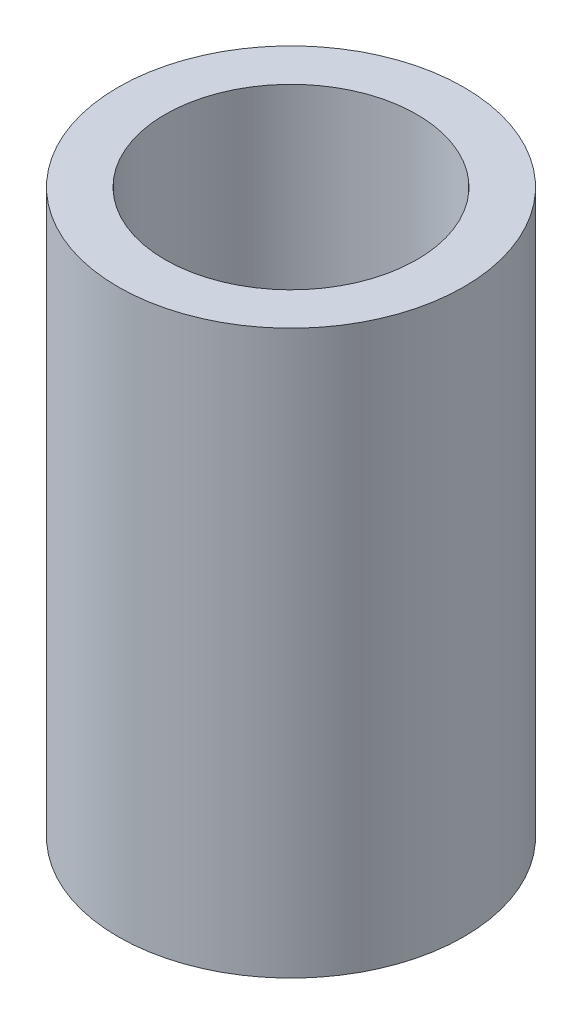
from build123d import *

# Parameters (mm, degrees)
SKETCH1_R           = 20
BOSS_EXTRUDE1_DEPTH = 65.100141422
SKETCH2_R           = 14.560455121
CUT_EXTRUDE1_DEPTH  = 71.979070247


with BuildPart() as part:
    # Sketch1 → Boss-Extrude1 (new body)
    with BuildSketch(Plane(origin=(0, 0, 0), x_dir=(1, 0, 0), z_dir=(0, 1, 0))):
        Circle(SKETCH1_R)
    extrude(amount=BOSS_EXTRUDE1_DEPTH)

    # Sketch2 → Cut-Extrude1 (cut, through all)
    with BuildSketch(Plane(origin=(0, 0, 0), x_dir=(1, 0, 0), z_dir=(0, 1, 0))):
        Circle(SKETCH2_R)
    extrude(amount=CUT_EXTRUDE1_DEPTH, mode=Mode.SUBTRACT)


solid = part.part
